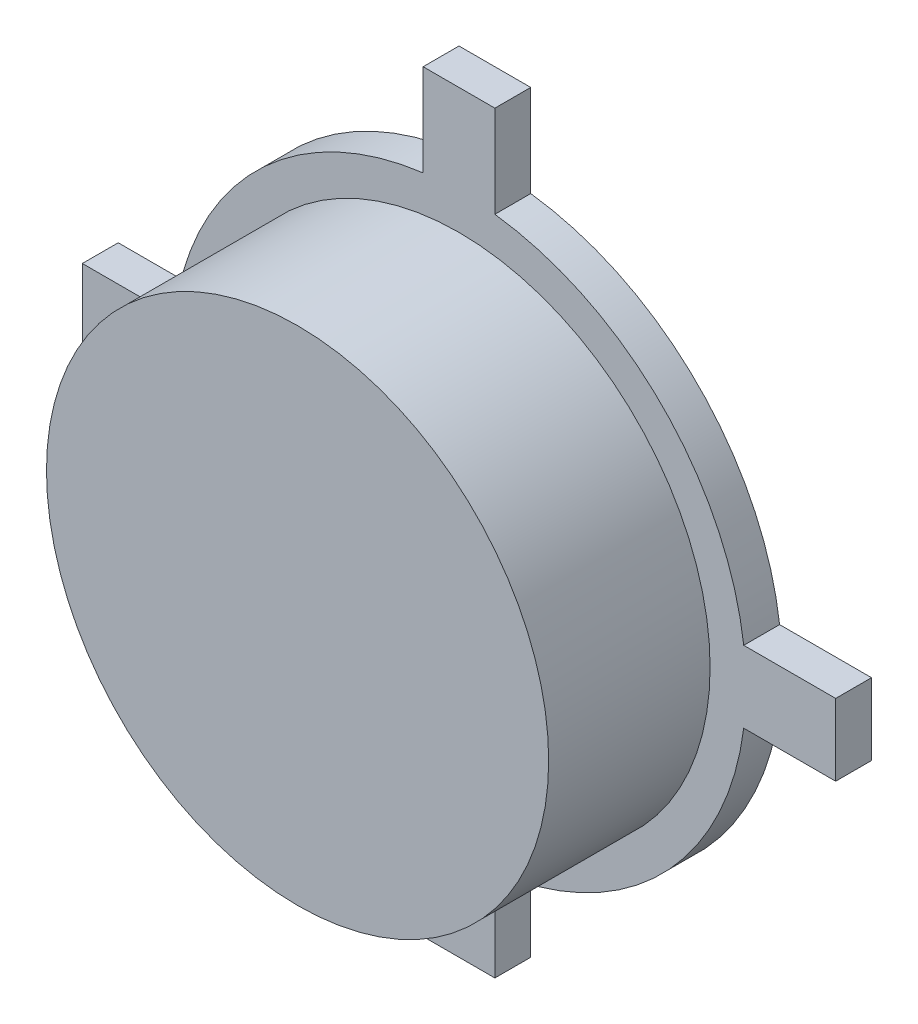
from build123d import *

# Parameters (mm, degrees)
SKETCH1_R           = 7
BOSS_EXTRUDE1_DEPTH = 4.5
BOSS_EXTRUDE3_DEPTH = 1


with BuildPart() as part:
    # Sketch1 → Boss-Extrude1 (new body)
    with BuildSketch(Plane.XY):
        Circle(SKETCH1_R)
    extrude(amount=BOSS_EXTRUDE1_DEPTH)

    # Sketch4 → Boss-Extrude3 (add)
    with BuildSketch(Plane(origin=(0, 0, 0), x_dir=(-1, 0, 0), z_dir=(0, 0, -1))):
        with BuildLine():
            Line((10.5, 1), (7.937253933, 1))
            ThreePointArc((7.937253933, 1), (5.656854249, 5.656854249), (1, 7.937253933))
            Line((1, 7.937253933), (1, 10.5))
            Line((1, 10.5), (-1, 10.5))
            Line((-1, 10.5), (-1, 7.937253933))
            ThreePointArc((-1, 7.937253933), (-5.656854249, 5.656854249), (-7.937253933, 1))
            Line((-7.937253933, 1), (-10.5, 1))
            Line((-10.5, 1), (-10.5, -1))
            Line((-10.5, -1), (-7.937253933, -1))
            ThreePointArc((-7.937253933, -1), (-5.656854249, -5.656854249), (-1, -7.937253933))
            Line((-1, -7.937253933), (-1, -10.5))
            Line((-1, -10.5), (1, -10.5))
            Line((1, -10.5), (1, -7.937253933))
            ThreePointArc((1, -7.937253933), (5.656854249, -5.656854249), (7.937253933, -1))
            Line((7.937253933, -1), (10.5, -1))
            Line((10.5, -1), (10.5, 1))
        make_face()
    extrude(amount=BOSS_EXTRUDE3_DEPTH)


solid = part.part
